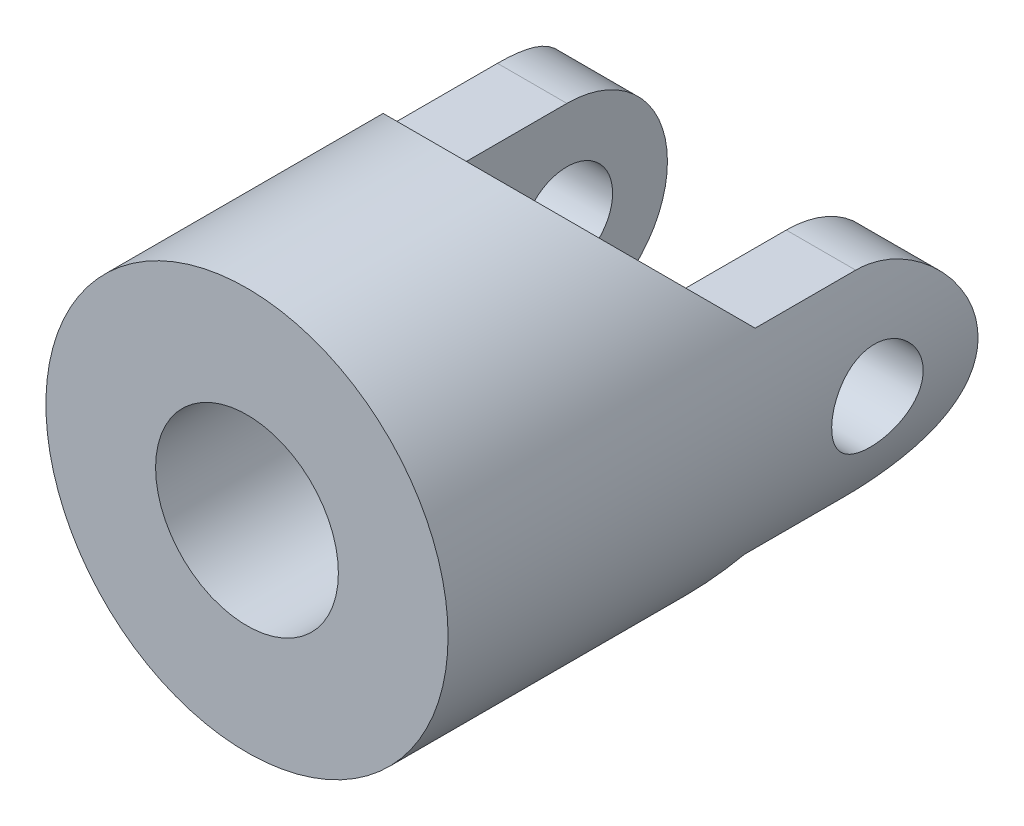
from build123d import *
from OCP.BRepAlgoAPI import BRepAlgoAPI_Cut
from OCP.TopTools import TopTools_ListOfShape

# Parameters (mm, degrees)
SKETCH_1_R               = 11
EXTRUDE_1_DEPTH          = 29
CUT_EXTRUDE_1_DEPTH      = 29
CUT_EXTRUDE_1_DEPTH_BACK = 29
SKETCH_3_W               = 12
SKETCH_3_H               = 23.957820674
CUT_EXTRUDE_2_DEPTH      = 14
FILLET_START             = -11
FILLET_1_DEPTH           = 21.999997277
SKETCH_4_R               = 5
CUT_EXTRUDE_3_DEPTH      = 17
CUT_EXTRUDE_4_DEPTH      = 17
CUT_EXTRUDE_4_DEPTH_BACK = 17
SKETCH_5_R               = 2.5


with BuildPart() as part:
    # 草图1 → 凸台-拉伸1 (new body)
    with BuildSketch(Plane.XY):
        with Locations(Location((0, 0, 0), (0, 0, 180))):
            Circle(SKETCH_1_R)
    extrude(amount=EXTRUDE_1_DEPTH)

    # 草图2 → 切除-拉伸1 (cut, two sides: drawn at the far end of the back side and taken through both)
    with BuildSketch(Plane(origin=(0, 0, 0), x_dir=(0, 0, -1), z_dir=(1, 0, 0)).offset(-CUT_EXTRUDE_1_DEPTH_BACK)):
        Polygon((0, 5), (0, 11), (-17, 11), (-11, 5), align=None)
        Polygon((-17, -12), (0, -12), (0, -6), (-11, -6), align=None)
    extrude(amount=CUT_EXTRUDE_1_DEPTH + CUT_EXTRUDE_1_DEPTH_BACK, mode=Mode.SUBTRACT)

    # 草图3 → 切除-拉伸2 (cut)
    with BuildSketch(Plane(origin=(0, 0, 0), x_dir=(-1, 0, 0), z_dir=(0, 0, -1))):
        Rectangle(SKETCH_3_W, SKETCH_3_H)
    extrude(amount=-CUT_EXTRUDE_2_DEPTH, mode=Mode.SUBTRACT)


with BuildPart() as fillet_1_tool:
    # 圆角1: read off the stored shape, not the designer's step
    # 圆角1 outline → 圆角1 (new body)
    with BuildSketch(Plane.YZ.offset(FILLET_START)):
        with BuildLine():
            Line((-6, 0), (-0.5, 0))
            ThreePointArc((-0.5, 0), (-4.389087297, 1.610912703), (-6, 5.5))
            Line((-6, 5.5), (-6, 0))
        make_face()
        with BuildLine():
            ThreePointArc((5, 5.5), (3.389087297, 1.610912703), (-0.5, 0))
            Line((-0.5, 0), (5, 0))
            Line((5, 0), (5, 5.5))
        make_face()
    extrude(amount=FILLET_1_DEPTH)


with BuildPart() as part_1:
    add(part.part)

    # 圆角1: cut by fillet_1_tool, with a tolerance
    fillet_1_stock = TopTools_ListOfShape()
    fillet_1_stock.Append(part_1.part.wrapped)
    fillet_1_tools = TopTools_ListOfShape()
    fillet_1_tools.Append(fillet_1_tool.part.wrapped)
    fillet_1_cut = BRepAlgoAPI_Cut()
    fillet_1_cut.SetArguments(fillet_1_stock)
    fillet_1_cut.SetTools(fillet_1_tools)
    fillet_1_cut.SetFuzzyValue(0.00001)
    fillet_1_cut.Build()
    add(Compound.cast(fillet_1_cut.Shape()).solids(), mode=Mode.REPLACE)

    # 草图4 → 切除-拉伸3 (cut)
    with BuildSketch(Plane.XY.offset(29)):
        Circle(SKETCH_4_R)
    extrude(amount=-CUT_EXTRUDE_3_DEPTH, mode=Mode.SUBTRACT)

    # 草图5 → 切除-拉伸4 (cut, two sides: drawn at the far end of the back side and taken through both)
    with BuildSketch(Plane(origin=(-6, 0, 0), x_dir=(0, 0, -1), z_dir=(1, 0, 0)).offset(-CUT_EXTRUDE_4_DEPTH_BACK)):
        with Locations(Location((-5.5, -0.5, 0), (0, 0, 11.536959033))):
            Circle(SKETCH_5_R)
    extrude(amount=CUT_EXTRUDE_4_DEPTH + CUT_EXTRUDE_4_DEPTH_BACK, mode=Mode.SUBTRACT)


solid = part_1.part
